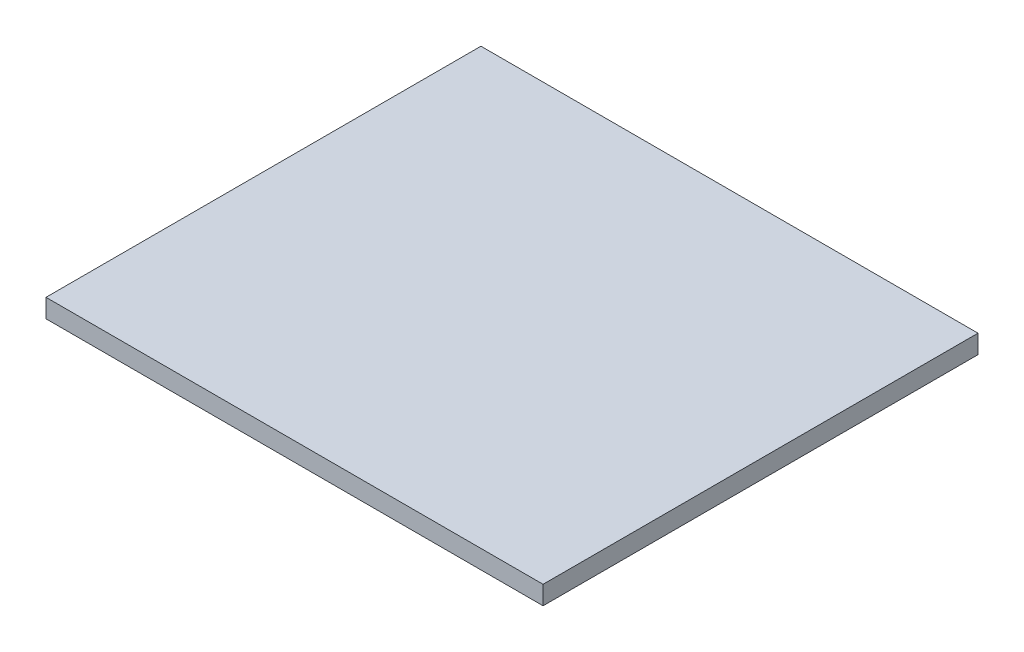
from build123d import *

# Parameters (mm, degrees)
SKETCH1_W           = 40
SKETCH1_H           = 35
BOSS_EXTRUDE1_DEPTH = 1.5


with BuildPart() as part:
    # Sketch1 → Boss-Extrude1 (new body)
    with BuildSketch(Plane(origin=(0, 0, 0), x_dir=(1, 0, 0), z_dir=(0, 1, 0))):
        Rectangle(SKETCH1_W, SKETCH1_H)
    extrude(amount=BOSS_EXTRUDE1_DEPTH)


solid = part.part
